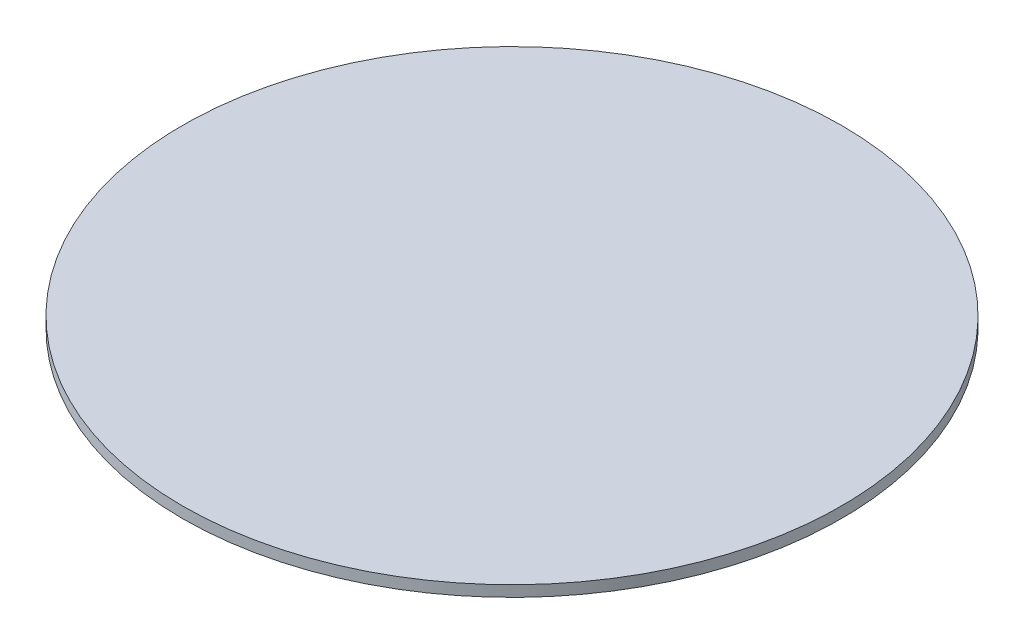
from build123d import *

# Parameters (mm, degrees)
SKETCH2_R           = 60
BOSS_EXTRUDE1_DEPTH = 2


with BuildPart() as part:
    # Sketch2 → Boss-Extrude1 (new body)
    with BuildSketch(Plane(origin=(0, 0, 0), x_dir=(1, 0, 0), z_dir=(0, 1, 0))):
        Circle(SKETCH2_R)
    extrude(amount=BOSS_EXTRUDE1_DEPTH)


solid = part.part
